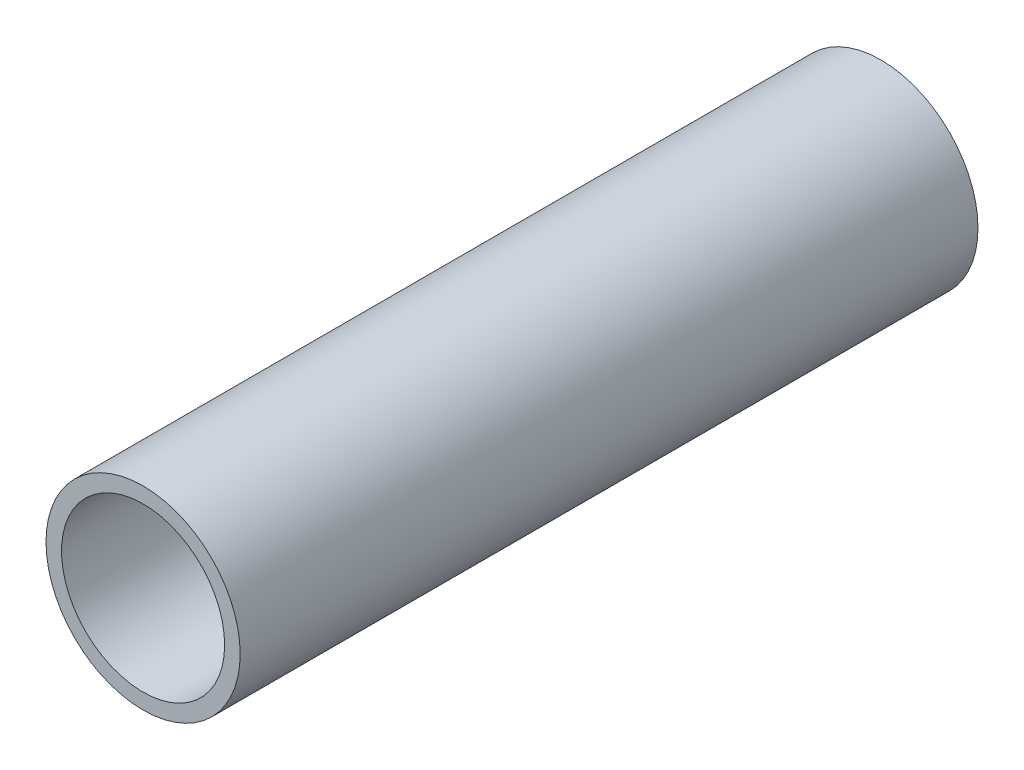
from build123d import *

# Parameters (mm, degrees)
SKETCH1_R           = 2.5
BOSS_EXTRUDE1_DEPTH = 19
CUT_EXTRUDE1_REACH  = 42.342
SKETCH3_R           = 1.6
SKETCH3_3_R         = 2.1
SKETCH3_3_R_2       = 1.6
CUT_EXTRUDE2_DEPTH  = 6


with BuildPart() as part:
    # Sketch1 → Boss-Extrude1 (new body)
    with BuildSketch(Plane.XY):
        with Locations((33, 0)):
            Circle(SKETCH1_R)
    extrude(amount=BOSS_EXTRUDE1_DEPTH)

    # Sketch3 → Cut-Extrude1 (cut, up to next)
    with BuildSketch(Plane.XY.offset(19), mode=Mode.PRIVATE) as cut_extrude1_sk1:
        with Locations((33, 0)):
            Circle(SKETCH3_R)
    cut_extrude1_tool1 = extrude(cut_extrude1_sk1.sketch, amount=-CUT_EXTRUDE1_REACH, mode=Mode.PRIVATE) & part.part
    add(cut_extrude1_tool1.solids().sort_by_distance((33, 0, 19))[0], mode=Mode.SUBTRACT)

    # Sketch3<3> → Cut-Extrude2 (cut)
    with BuildSketch(Plane.XY.offset(19)):
        with Locations((33, 0)):
            Circle(SKETCH3_3_R)
        with Locations((33, 0)):
            Circle(SKETCH3_3_R_2, mode=Mode.SUBTRACT)
    cut_extrude2 = extrude(amount=-CUT_EXTRUDE2_DEPTH, mode=Mode.SUBTRACT)

    # Mirror1: Cut-Extrude2 across plane
    add(cut_extrude2.mirror(Plane.XY.offset(9.5)), mode=Mode.SUBTRACT)


solid = part.part
